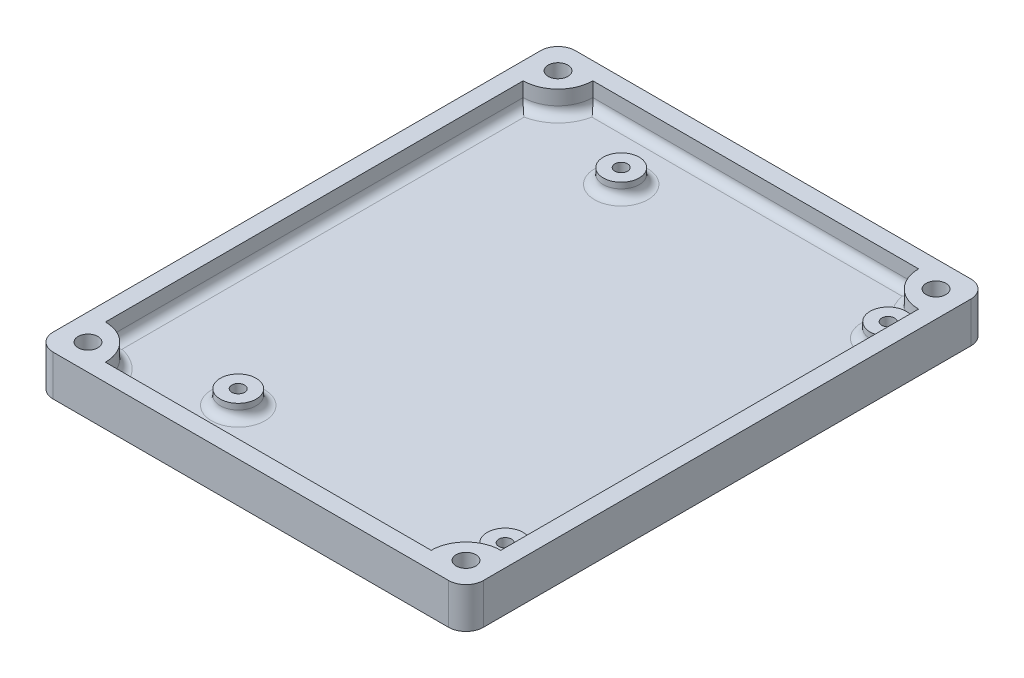
from build123d import *

# Parameters (mm, degrees)
SKETCH1_W                      = 74.142135624
SKETCH1_H                      = 90
BOSS_EXTRUDE1_DEPTH            = 3
SKETCH2_W                      = 74.142135624
SKETCH2_H                      = 90
BOSS_EXTRUDE2_DEPTH            = 4
CBORE_FOR_M3_SHCS1_D           = 3.4
CBORE_FOR_M3_SHCS1_CBORE_D     = 5.7
CBORE_FOR_M3_SHCS1_CBORE_DEPTH = 4
BOSS_EXTRUDE8_START            = 1.5
SKETCH5_R                      = 3.1
SKETCH5_R_2                    = 1.1
BOSS_EXTRUDE8_DEPTH            = 2.5
SKETCH6_R                      = 1.1
CUT_EXTRUDE1_DEPTH             = 1.5
FILLET1_R                      = 1.5
FILLET2_R                      = 3


with BuildPart() as part:
    # Sketch1 → Boss-Extrude1 (new body)
    with BuildSketch(Plane(origin=(0, 0, 0), x_dir=(1, 0, 0), z_dir=(0, 1, 0))):
        with Locations((-39.782232781, 69.958998281)):
            Rectangle(SKETCH1_W, SKETCH1_H)
    extrude(amount=BOSS_EXTRUDE1_DEPTH)

    # Sketch2 → Boss-Extrude2 (add)
    with BuildSketch(Plane(origin=(0, 3, 0), x_dir=(1, 0, 0), z_dir=(0, 1, 0))):
        with Locations((-39.782232781, 69.958998281)):
            Rectangle(SKETCH2_W, SKETCH2_H)
        with BuildLine():
            Line((-5.711164969, 33.958998281), (-5.711164969, 105.958998281))
            ThreePointArc((-5.711164969, 105.958998281), (-9.953805657, 107.716357594), (-11.711164969, 111.958998281))
            Line((-11.711164969, 111.958998281), (-67.853300593, 111.958998281))
            ThreePointArc((-67.853300593, 111.958998281), (-69.610659906, 107.716357594), (-73.853300593, 105.958998281))
            Line((-73.853300593, 105.958998281), (-73.853300593, 33.958998281))
            ThreePointArc((-73.853300593, 33.958998281), (-69.610659906, 32.201638968), (-67.853300593, 27.958998281))
            Line((-67.853300593, 27.958998281), (-11.711164969, 27.958998281))
            ThreePointArc((-11.711164969, 27.958998281), (-9.953805657, 32.201638968), (-5.711164969, 33.958998281))
        make_face(mode=Mode.SUBTRACT)
    extrude(amount=BOSS_EXTRUDE2_DEPTH)

    # CBORE for M3 SHCS1 (through all)
    with Locations(Plane(origin=(0, 0, 0), x_dir=(-1, 0, 0), z_dir=(0, -1, 0))):
        with Locations((72.353300593, 29.458998281), (7.211164969, 29.458998281), (7.211164969, 110.458998281), (72.353300593, 110.458998281)):
            CounterBoreHole(CBORE_FOR_M3_SHCS1_D / 2, CBORE_FOR_M3_SHCS1_CBORE_D / 2, CBORE_FOR_M3_SHCS1_CBORE_DEPTH)

    # Sketch5 → Boss-Extrude8 (add)
    # profile 1 of 4: a face of its own
    with BuildSketch(Plane(origin=(-76.853300593, 7, -114.958998281), x_dir=(1, 0, 0), z_dir=(0, -1, 0)).offset(BOSS_EXTRUDE8_START)):
        with Locations(Location((22.892135624, 12, 0), (0, 0, 90))):
            Circle(SKETCH5_R)
        with Locations(Location((22.892135624, 12, 0), (0, 0, 90))):
            Circle(SKETCH5_R_2, mode=Mode.SUBTRACT)
    # profile 2 of 4: a face of its own
    with BuildSketch(Plane(origin=(-76.853300593, 7, -114.958998281), x_dir=(1, 0, 0), z_dir=(0, -1, 0)).offset(BOSS_EXTRUDE8_START)):
        with Locations((68.892135624, 12)):
            Circle(SKETCH5_R)
        with Locations(Location((68.892135624, 12, 0), (0, 0, 90))):
            Circle(SKETCH5_R_2, mode=Mode.SUBTRACT)
    # profile 3 of 4: a face of its own
    with BuildSketch(Plane(origin=(-76.853300593, 7, -114.958998281), x_dir=(1, 0, 0), z_dir=(0, -1, 0)).offset(BOSS_EXTRUDE8_START)):
        with Locations((68.892135624, 78)):
            Circle(SKETCH5_R)
        with Locations(Location((68.892135624, 78, 0), (0, 0, 90))):
            Circle(SKETCH5_R_2, mode=Mode.SUBTRACT)
    # profile 4 of 4: a face of its own
    with BuildSketch(Plane(origin=(-76.853300593, 7, -114.958998281), x_dir=(1, 0, 0), z_dir=(0, -1, 0)).offset(BOSS_EXTRUDE8_START)):
        with Locations(Location((22.892135624, 78, 0), (0, 0, 90))):
            Circle(SKETCH5_R)
        with Locations(Location((22.892135624, 78, 0), (0, 0, 90))):
            Circle(SKETCH5_R_2, mode=Mode.SUBTRACT)
    extrude(amount=BOSS_EXTRUDE8_DEPTH)

    # Sketch6 → Cut-Extrude1 (cut)
    with BuildSketch(Plane(origin=(0, 3, 0), x_dir=(1, 0, 0), z_dir=(0, 1, 0))):
        with Locations(Location((-7.961164969, 36.958998281, 0), (0, 0, 270))):
            Circle(SKETCH6_R)
        with Locations(Location((-53.961164969, 36.958998281, 0), (0, 0, 270))):
            Circle(SKETCH6_R)
        with Locations(Location((-53.961164969, 102.958998281, 0), (0, 0, 270))):
            Circle(SKETCH6_R)
        with Locations(Location((-7.961164969, 102.958998281, 0), (0, 0, 270))):
            Circle(SKETCH6_R)
    extrude(amount=-CUT_EXTRUDE1_DEPTH, mode=Mode.SUBTRACT)

    # Fillet1
    # the kernel refuses this fillet: 1.5 mm, written as the material it adds along each edge
    with BuildSketch(Plane(origin=(-73.853300593, 3, -27.958998281), x_dir=(-0.5853008610590891, 0, -0.8108161949810135), z_dir=(-0.8108161949810135, 0, 0.5853008610590891))) as fillet1_piece_1_section:
        with BuildLine():
            CenterArc((6 + FILLET1_R, -FILLET1_R), FILLET1_R, 90, 90)
            Line((6, -FILLET1_R), (6, 0))
            Line((6, 0), (6 + FILLET1_R, 0))
        make_face()
    fillet1_piece_1 = revolve(axis=Axis((-73.853300593, 3, -27.958998281), (0, -1, 0)), revolution_arc=125.824247309, mode=Mode.PRIVATE)
    fillet1_piece_1 = split(fillet1_piece_1, bisect_by=Plane(origin=(-76.853300593, 3.427407816, -32.503861933), z_dir=(1, 0, 0)), keep=Keep.TOP, mode=Mode.PRIVATE)
    add(fillet1_piece_1)
    with BuildSketch(Plane(origin=(-53.961164969, 3, -36.958998281), x_dir=(0, 0, 1), z_dir=(1, 0, 0))) as fillet1_piece_2:
        with BuildLine():
            CenterArc((3.1 + FILLET1_R, -FILLET1_R), FILLET1_R, 90, 90)
            Line((3.1, -FILLET1_R), (3.1, 0))
            Line((3.1, 0), (3.1 + FILLET1_R, 0))
        make_face()
    revolve(axis=Axis((-53.961164969, 3, -36.958998281), (0, -1, 0)))
    with BuildSketch(Plane(origin=(-5.711164969, 3, -27.958998281), x_dir=(-1, 0, 0), z_dir=(0, 0, 1))) as fillet1_piece_3:
        with BuildLine():
            CenterArc((6 + FILLET1_R, -FILLET1_R), FILLET1_R, 90, 90)
            Line((6, -FILLET1_R), (6, 0))
            Line((6, 0), (6 + FILLET1_R, 0))
        make_face()
    revolve(axis=Axis((-5.711164969, 3, -27.958998281), (0, -1, 0)), revolution_arc=90)
    with BuildSketch(Plane(origin=(-7.961164969, 3, -36.958998281), x_dir=(0.9999950652018581, 0, 0.0031415874858777702), z_dir=(0.0031415874858777702, 0, -0.9999950652018581))) as fillet1_piece_4:
        with BuildLine():
            CenterArc((3.1 + FILLET1_R, -FILLET1_R), FILLET1_R, 90, 90)
            Line((3.1, -FILLET1_R), (3.1, 0))
            Line((3.1, 0), (3.1 + FILLET1_R, 0))
        make_face()
    revolve(axis=Axis((-7.961164969, 3, -36.958998281), (0, -1, 0)), revolution_arc=359.64)
    with BuildSketch(Plane(origin=(-5.711164969, 3, -35.341485092), x_dir=(-1, 0, 0), z_dir=(0, 0, -1))) as fillet1_piece_5_section:
        with BuildLine():
            CenterArc((FILLET1_R, FILLET1_R), FILLET1_R, 180, 90)
            Line((0, FILLET1_R), (0, 0))
            Line((0, 0), (FILLET1_R, 0))
        make_face()
    fillet1_piece_5 = extrude(amount=69.235026378, mode=Mode.PRIVATE)
    fillet1_piece_5 = fillet1_piece_5 - Plane(origin=(-7.961164969, 3.336189736, -102.958998281), x_dir=(0, 0, 1), z_dir=(0, 1, 0)) * Cylinder(1.1, 145, mode=Mode.PRIVATE)
    fillet1_piece_5 = fillet1_piece_5 - Plane(origin=(-7.961164969, 3.336189736, -36.958998281), x_dir=(0, 0, 1), z_dir=(0, 1, 0)) * Cylinder(1.1, 145, mode=Mode.PRIVATE)
    add(fillet1_piece_5)
    with BuildSketch(Plane(origin=(-7.961164969, 3, -102.958998281), x_dir=(0.9999950652018581, 0, 0.0031415874858777702), z_dir=(0.0031415874858777702, 0, -0.9999950652018581))) as fillet1_piece_6:
        with BuildLine():
            CenterArc((3.1 + FILLET1_R, -FILLET1_R), FILLET1_R, 90, 90)
            Line((3.1, -FILLET1_R), (3.1, 0))
            Line((3.1, 0), (3.1 + FILLET1_R, 0))
        make_face()
    revolve(axis=Axis((-7.961164969, 3, -102.958998281), (0, -1, 0)), revolution_arc=359.64)
    with BuildSketch(Plane(origin=(-5.711164969, 3, -111.958998281), x_dir=(0, 0, 1), z_dir=(1, 0, 0))) as fillet1_piece_7:
        with BuildLine():
            CenterArc((6 + FILLET1_R, -FILLET1_R), FILLET1_R, 90, 90)
            Line((6, -FILLET1_R), (6, 0))
            Line((6, 0), (6 + FILLET1_R, 0))
        make_face()
    revolve(axis=Axis((-5.711164969, 3, -111.958998281), (0, -1, 0)), revolution_arc=90)
    with BuildSketch(Plane(origin=(-73.853300593, 3, -109.708998281), x_dir=(1, 0, 0), z_dir=(0, 0, 1))) as fillet1_piece_8_section:
        with BuildLine():
            CenterArc((FILLET1_R, FILLET1_R), FILLET1_R, 180, 90)
            Line((0, FILLET1_R), (0, 0))
            Line((0, 0), (FILLET1_R, 0))
        make_face()
    fillet1_piece_8 = extrude(amount=79.5, mode=Mode.PRIVATE)
    fillet1_piece_8 = fillet1_piece_8 - Plane(origin=(-73.853300593, 3.311177076, -111.958998281), x_dir=(1, 0, 0), z_dir=(0, -1, 0)) * Cylinder(6, 165, mode=Mode.PRIVATE)
    fillet1_piece_8 = fillet1_piece_8 - Plane(origin=(-73.853300593, 3.311177076, -27.958998281), x_dir=(0, 0, -1), z_dir=(0, -1, 0)) * Cylinder(6, 165, mode=Mode.PRIVATE)
    add(fillet1_piece_8)
    with BuildSketch(Plane(origin=(-73.853300593, 3, -111.958998281), x_dir=(1, 0, 0), z_dir=(0, 0, -1))) as fillet1_piece_9_section:
        with BuildLine():
            CenterArc((6 + FILLET1_R, -FILLET1_R), FILLET1_R, 90, 90)
            Line((6, -FILLET1_R), (6, 0))
            Line((6, 0), (6 + FILLET1_R, 0))
        make_face()
    fillet1_piece_9 = revolve(axis=Axis((-73.853300593, 3, -111.958998281), (0, -1, 0)), revolution_arc=125.824247309, mode=Mode.PRIVATE)
    fillet1_piece_9 = split(fillet1_piece_9, bisect_by=Plane(origin=(-76.853300593, 3.427407819, -107.414134627), z_dir=(1, 0, 0)), keep=Keep.TOP, mode=Mode.PRIVATE)
    add(fillet1_piece_9)
    with BuildSketch(Plane(origin=(-7.961164969, 3, -111.958998281), x_dir=(0, 1, 0), z_dir=(-1, 0, 0))) as fillet1_piece_10_section:
        with BuildLine():
            CenterArc((FILLET1_R, -FILLET1_R), FILLET1_R, 90, 90)
            Line((0, -FILLET1_R), (0, 0))
            Line((0, 0), (FILLET1_R, 0))
        make_face()
    fillet1_piece_10 = extrude(amount=63.642135624, mode=Mode.PRIVATE)
    fillet1_piece_10 = fillet1_piece_10 - Plane(origin=(-5.711164969, 4.124273766, -111.958998281), x_dir=(0, 0, 1), z_dir=(0, -1, 0)) * Cylinder(6, 134, mode=Mode.PRIVATE)
    fillet1_piece_10 = fillet1_piece_10 - Plane(origin=(-73.853300593, 4.124273766, -111.958998281), x_dir=(1, 0, 0), z_dir=(0, -1, 0)) * Cylinder(6, 134, mode=Mode.PRIVATE)
    add(fillet1_piece_10)
    with BuildSketch(Plane(origin=(-53.961164969, 3, -102.958998281), x_dir=(0, 0, 1), z_dir=(1, 0, 0))) as fillet1_piece_11:
        with BuildLine():
            CenterArc((3.1 + FILLET1_R, -FILLET1_R), FILLET1_R, 90, 90)
            Line((3.1, -FILLET1_R), (3.1, 0))
            Line((3.1, 0), (3.1 + FILLET1_R, 0))
        make_face()
    revolve(axis=Axis((-53.961164969, 3, -102.958998281), (0, -1, 0)))
    with BuildSketch(Plane(origin=(-71.603300593, 3, -27.958998281), x_dir=(0, 0, -1), z_dir=(1, 0, 0))) as fillet1_piece_12_section:
        with BuildLine():
            CenterArc((FILLET1_R, FILLET1_R), FILLET1_R, 180, 90)
            Line((0, FILLET1_R), (0, 0))
            Line((0, 0), (FILLET1_R, 0))
        make_face()
    fillet1_piece_12 = extrude(amount=63.642135624, mode=Mode.PRIVATE)
    fillet1_piece_12 = fillet1_piece_12 - Plane(origin=(-5.711164969, 3.311153627, -27.958998281), x_dir=(-1, 0, 0), z_dir=(0, -1, 0)) * Cylinder(6, 134, mode=Mode.PRIVATE)
    fillet1_piece_12 = fillet1_piece_12 - Plane(origin=(-73.853300593, 3.311153627, -27.958998281), x_dir=(0, 0, -1), z_dir=(0, -1, 0)) * Cylinder(6, 134, mode=Mode.PRIVATE)
    add(fillet1_piece_12)

    # Fillet2
    fillet2_edges = [part.edges().sort_by_distance(p)[0] for p in [
        (-2.711164969, 3.5, -24.958998281),
        (-76.853300593, 3.5, -24.958998281),
        (-76.853300593, 3.5, -114.958998281),
        (-2.711164969, 3.5, -114.958998281),
    ]]
    fillet(fillet2_edges, radius=FILLET2_R)


solid = part.part
